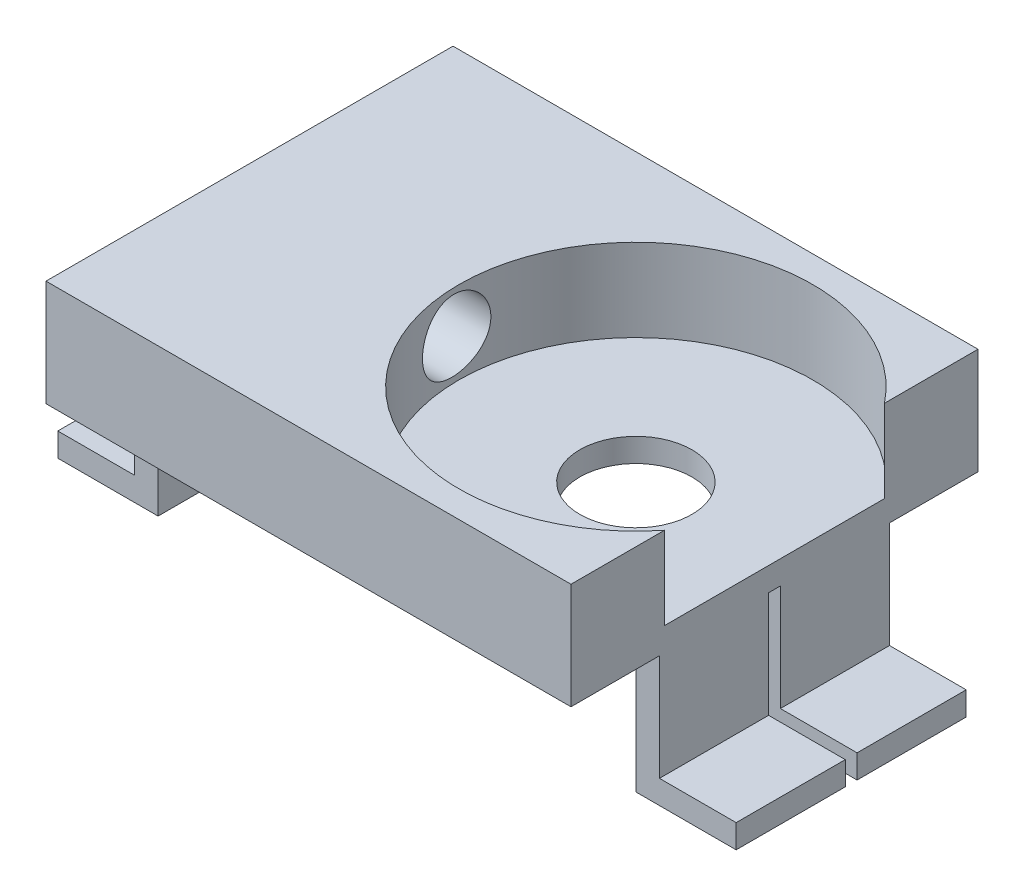
from build123d import *

# Parameters (mm, degrees)
BOSS_EXTRUDE1_DEPTH = 34.5
SKETCH3_R           = 15
CUT_EXTRUDE1_DEPTH  = 7
SKETCH4_W           = 7.5
SKETCH4_H           = 11
CUT_EXTRUDE2_DEPTH  = 70.974995534
SKETCH5_R           = 4.75
CUT_EXTRUDE3_DEPTH  = 55.357268886
SKETCH6_W           = 1
SKETCH6_H           = 11
CUT_EXTRUDE4_DEPTH  = 70.974995534
CUT_EXTRUDE5_REACH  = 66.74
SKETCH7_R           = 3


with BuildPart() as part:
    # Sketch1 → Boss-Extrude1 (new body)
    with BuildSketch(Plane.XY):
        Polygon((-9.056756757, 11), (31.443243243, 11), (31.443243243, 0), (39.943243243, 0), (39.943243243, 2), (33.443243243, 2), (33.443243243, 20), (-11.056756757, 20), (-11.056756757, 2), (-17.556756757, 2), (-17.556756757, 0), (-9.056756757, 0), align=None)
    extrude(amount=BOSS_EXTRUDE1_DEPTH)

    # Sketch3 → Cut-Extrude1 (cut)
    with BuildSketch(Plane(origin=(0, 20, 0), x_dir=(1, 0, 0), z_dir=(0, 1, 0))):
        with Locations((21.693243243, -17.25)):
            Circle(SKETCH3_R)
    extrude(amount=-CUT_EXTRUDE1_DEPTH, mode=Mode.SUBTRACT)

    # Sketch4 → Cut-Extrude2 (cut, through all)
    with BuildSketch(Plane.ZY.offset(17.556756757)):
        with Locations((3.75, 5.5)):
            Rectangle(SKETCH4_W, SKETCH4_H)
        with Locations((30.75, 5.5)):
            Rectangle(SKETCH4_W, SKETCH4_H)
    extrude(amount=-CUT_EXTRUDE2_DEPTH, mode=Mode.SUBTRACT)

    # Sketch5 → Cut-Extrude3 (cut, through all)
    with BuildSketch(Plane(origin=(0, 13, 0), x_dir=(1, 0, 0), z_dir=(0, 1, 0))):
        with Locations((21.693243243, -17.25)):
            Circle(SKETCH5_R)
    extrude(amount=-CUT_EXTRUDE3_DEPTH, mode=Mode.SUBTRACT)

    # Sketch6 → Cut-Extrude4 (cut, through all)
    with BuildSketch(Plane(origin=(39.943243243, 0, 0), x_dir=(0, 0, -1), z_dir=(1, 0, 0))):
        with Locations((-17.25, 5.5)):
            Rectangle(SKETCH6_W, SKETCH6_H)
    extrude(amount=-CUT_EXTRUDE4_DEPTH, mode=Mode.SUBTRACT)

    # Sketch7 → Cut-Extrude5 (cut, up to next)
    with BuildSketch(Plane.ZY.offset(11.056756757), mode=Mode.PRIVATE) as cut_extrude5_sk1:
        with Locations((17.75, 16.5)):
            Circle(SKETCH7_R)
    cut_extrude5_tool1 = extrude(cut_extrude5_sk1.sketch, amount=-CUT_EXTRUDE5_REACH, mode=Mode.PRIVATE) & part.part
    add(cut_extrude5_tool1.solids().sort_by_distance((-11.056757, 16.5, 17.75))[0], mode=Mode.SUBTRACT)


solid = part.part
